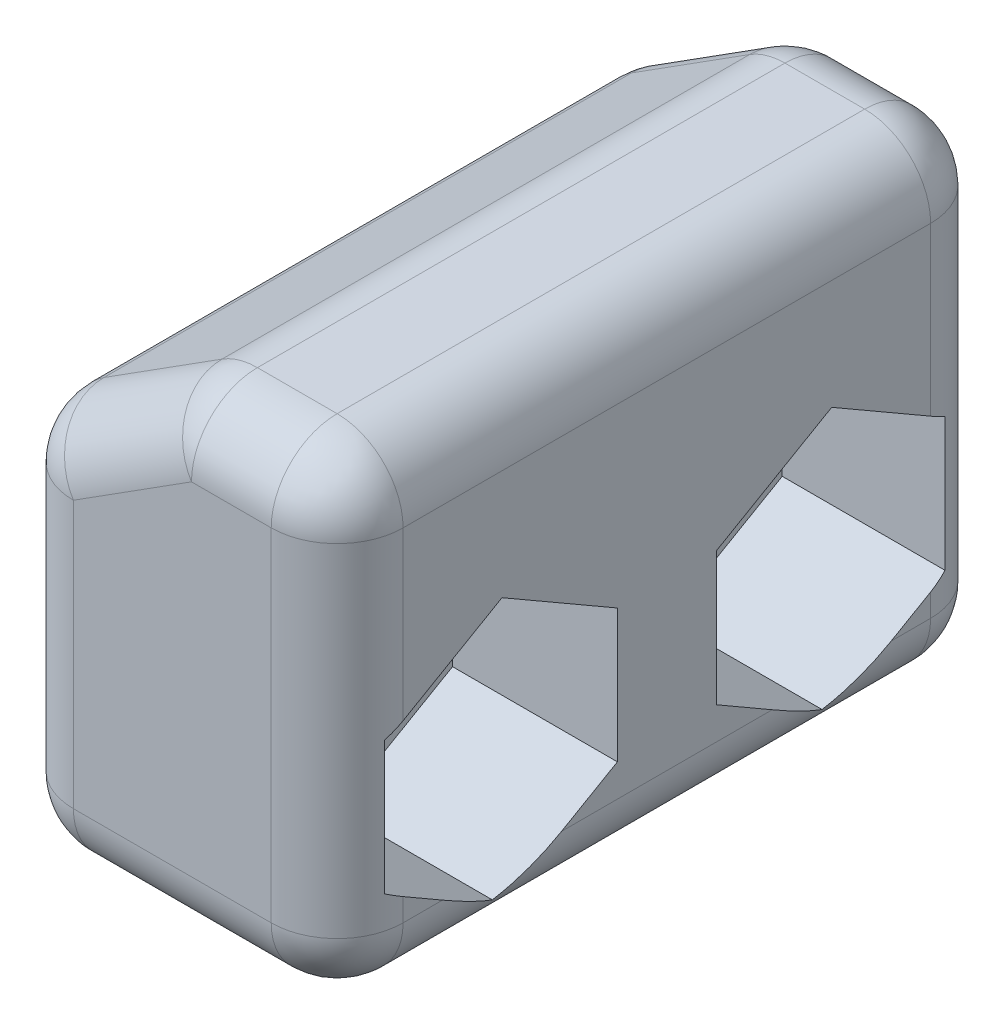
from build123d import *

# Parameters (mm, degrees)
BOSS_EXTRUDE1_DEPTH = 25.4
SKETCH4_R           = 2.159
CUT_EXTRUDE1_DEPTH  = 34.76004538
CUT_EXTRUDE2_DEPTH  = 6.35
FILLET1_R           = 2.54


with BuildPart() as part:
    # Sketch3 → Boss-Extrude1 (new body)
    with BuildSketch(Plane.XY):
        Polygon((0, 14.224), (6.35, 18.25625), (12.7, 18.25625), (12.7, 0), (0, 0), align=None)
    extrude(amount=BOSS_EXTRUDE1_DEPTH)

    # Sketch4 → Cut-Extrude1 (cut, through all)
    with BuildSketch(Plane.ZY):
        with Locations((6.35, 6.35)):
            Circle(SKETCH4_R)
        with Locations((19.05, 6.35)):
            Circle(SKETCH4_R)
    extrude(amount=-CUT_EXTRUDE1_DEPTH, mode=Mode.SUBTRACT)

    # Sketch6 → Cut-Extrude2 (cut)
    with BuildSketch(Plane(origin=(12.7, 0, 0), x_dir=(0, 0, -1), z_dir=(1, 0, 0))):
        Polygon((-14.605, 8.916321947), (-19.05, 11.482643893), (-23.495, 8.916321947), (-23.495, 3.783678053), (-19.05, 1.217356107), (-14.605, 3.783678053), align=None)
        Polygon((-1.905, 3.783678053), (-1.905, 8.916321947), (-6.35, 11.482643893), (-10.795, 8.916321947), (-10.795, 3.783678053), (-6.35, 1.217356107), align=None)
    extrude(amount=-CUT_EXTRUDE2_DEPTH, mode=Mode.SUBTRACT)

    # Fillet1
    # the kernel refuses this fillet: 2.54 mm, written as the material it takes off along each edge
    with BuildSketch(Plane(origin=(2.54, 2.54, 2.54), x_dir=(0, 0, -1), z_dir=(-1, 0, 0))) as fillet1_piece_1_section:
        Polygon((0, 0), (FILLET1_R, 0), (FILLET1_R, FILLET1_R), (0, FILLET1_R), align=None)
    fillet1_piece_1 = extrude(amount=FILLET1_R, mode=Mode.PRIVATE)
    fillet1_piece_1 = fillet1_piece_1 - Plane(origin=(2.54, 2.54, 2.54), x_dir=(0, 0.7071067811865475, 0.7071067811865475), z_dir=(-1, 0, 0)) * Sphere(FILLET1_R, mode=Mode.PRIVATE)
    add(fillet1_piece_1, mode=Mode.SUBTRACT)
    with BuildSketch(Plane(origin=(2.54, 2.54, 22.86), x_dir=(0, 0, 1), z_dir=(-1, 0, 0))) as fillet1_piece_2_section:
        Polygon((0, 0), (FILLET1_R, 0), (FILLET1_R, -FILLET1_R), (0, -FILLET1_R), align=None)
    fillet1_piece_2 = extrude(amount=FILLET1_R, mode=Mode.PRIVATE)
    fillet1_piece_2 = fillet1_piece_2 - Plane(origin=(2.54, 2.54, 22.86), x_dir=(0, 0.7071067811865475, -0.7071067811865475), z_dir=(-1, 0, 0)) * Sphere(FILLET1_R, mode=Mode.PRIVATE)
    add(fillet1_piece_2, mode=Mode.SUBTRACT)
    with BuildSketch(Plane(origin=(10.16, 2.54, 2.54), x_dir=(0, 0, -1), z_dir=(1, 0, 0))) as fillet1_piece_3_section:
        Polygon((0, 0), (FILLET1_R, 0), (FILLET1_R, -FILLET1_R), (0, -FILLET1_R), align=None)
    fillet1_piece_3 = extrude(amount=FILLET1_R, mode=Mode.PRIVATE)
    fillet1_piece_3 = fillet1_piece_3 - Plane(origin=(10.16, 2.54, 2.54), x_dir=(0, 0.7071067811865475, 0.7071067811865475), z_dir=(1, 0, 0)) * Sphere(FILLET1_R, mode=Mode.PRIVATE)
    add(fillet1_piece_3, mode=Mode.SUBTRACT)
    with BuildSketch(Plane(origin=(10.16, 2.54, 22.86), x_dir=(0, 0, 1), z_dir=(1, 0, 0))) as fillet1_piece_4_section:
        Polygon((0, 0), (FILLET1_R, 0), (FILLET1_R, FILLET1_R), (0, FILLET1_R), align=None)
    fillet1_piece_4 = extrude(amount=FILLET1_R, mode=Mode.PRIVATE)
    fillet1_piece_4 = fillet1_piece_4 - Plane(origin=(10.16, 2.54, 22.86), x_dir=(0, 0.7071067811865475, -0.7071067811865475), z_dir=(1, 0, 0)) * Sphere(FILLET1_R, mode=Mode.PRIVATE)
    add(fillet1_piece_4, mode=Mode.SUBTRACT)
    with BuildSketch(Plane(origin=(10.16, 15.71625, 2.54), x_dir=(0, 1, 0), z_dir=(1, 0, 0))) as fillet1_piece_5_section:
        Polygon((0, 0), (FILLET1_R, 0), (FILLET1_R, -FILLET1_R), (0, -FILLET1_R), align=None)
    fillet1_piece_5 = extrude(amount=FILLET1_R, mode=Mode.PRIVATE)
    fillet1_piece_5 = fillet1_piece_5 - Plane(origin=(10.16, 15.71625, 2.54), x_dir=(0, -0.7071067811865475, 0.7071067811865475), z_dir=(1, 0, 0)) * Sphere(FILLET1_R, mode=Mode.PRIVATE)
    add(fillet1_piece_5, mode=Mode.SUBTRACT)
    with BuildSketch(Plane(origin=(10.16, 15.71625, 22.86), x_dir=(0, 1, 0), z_dir=(1, 0, 0))) as fillet1_piece_6_section:
        Polygon((0, 0), (FILLET1_R, 0), (FILLET1_R, FILLET1_R), (0, FILLET1_R), align=None)
    fillet1_piece_6 = extrude(amount=FILLET1_R, mode=Mode.PRIVATE)
    fillet1_piece_6 = fillet1_piece_6 - Plane(origin=(10.16, 15.71625, 22.86), x_dir=(0, -0.7071067811865475, -0.7071067811865475), z_dir=(1, 0, 0)) * Sphere(FILLET1_R, mode=Mode.PRIVATE)
    add(fillet1_piece_6, mode=Mode.SUBTRACT)
    with BuildSketch(Plane(origin=(7.088311936, 15.71625, 2.54), x_dir=(-0.5360558854014316, 0.8441824966951682, 0), z_dir=(0, 0, -1))) as fillet1_piece_7_section:
        Polygon((0, 0), (FILLET1_R, 0), (FILLET1_R, FILLET1_R * 0.290673990433), (FILLET1_R * 0.844182496695, FILLET1_R * 0.536055885401), align=None)
    fillet1_piece_7 = extrude(amount=FILLET1_R, mode=Mode.PRIVATE)
    fillet1_piece_7 = fillet1_piece_7 - Plane(origin=(7.088311936, 15.71625, 2.54), x_dir=(0.2791213923231542, -0.9602558244278364, 0), z_dir=(0, 0, -1)) * Sphere(FILLET1_R, mode=Mode.PRIVATE)
    add(fillet1_piece_7, mode=Mode.SUBTRACT)
    with BuildSketch(Plane(origin=(7.088311936, 15.71625, 22.86), x_dir=(-0.5360558854014316, 0.8441824966951682, 0), z_dir=(0, 0, 1))) as fillet1_piece_8_section:
        Polygon((0, 0), (FILLET1_R, 0), (FILLET1_R, -FILLET1_R * 0.290673990433), (FILLET1_R * 0.844182496695, -FILLET1_R * 0.536055885401), align=None)
    fillet1_piece_8 = extrude(amount=FILLET1_R, mode=Mode.PRIVATE)
    fillet1_piece_8 = fillet1_piece_8 - Plane(origin=(7.088311936, 15.71625, 22.86), x_dir=(0.2791213923231542, -0.9602558244278364, 0), z_dir=(0, 0, 1)) * Sphere(FILLET1_R, mode=Mode.PRIVATE)
    add(fillet1_piece_8, mode=Mode.SUBTRACT)
    with BuildSketch(Plane(origin=(2.54, 12.828071921, 22.86), x_dir=(-0.5360558854014316, 0.8441824966951682, 0), z_dir=(0, 0, 1))) as fillet1_piece_9_section:
        Polygon((0, 0), (FILLET1_R, 0), (FILLET1_R, FILLET1_R * 0.549577983925), (FILLET1_R * 0.536055885401, FILLET1_R * 0.844182496695), align=None)
    fillet1_piece_9 = extrude(amount=FILLET1_R, mode=Mode.PRIVATE)
    fillet1_piece_9 = fillet1_piece_9 - Plane(origin=(2.54, 12.828071921, 22.86), x_dir=(0.8763720344127349, -0.4816347758408693, 0), z_dir=(0, 0, 1)) * Sphere(FILLET1_R, mode=Mode.PRIVATE)
    add(fillet1_piece_9, mode=Mode.SUBTRACT)
    with BuildSketch(Plane(origin=(2.54, 12.828071921, 2.54), x_dir=(-0.5360558854014316, 0.8441824966951682, 0), z_dir=(0, 0, -1))) as fillet1_piece_10_section:
        Polygon((0, 0), (FILLET1_R, 0), (FILLET1_R, -FILLET1_R * 0.549577983925), (FILLET1_R * 0.536055885401, -FILLET1_R * 0.844182496695), align=None)
    fillet1_piece_10 = extrude(amount=FILLET1_R, mode=Mode.PRIVATE)
    fillet1_piece_10 = fillet1_piece_10 - Plane(origin=(2.54, 12.828071921, 2.54), x_dir=(0.8763720344127349, -0.4816347758408693, 0), z_dir=(0, 0, -1)) * Sphere(FILLET1_R, mode=Mode.PRIVATE)
    add(fillet1_piece_10, mode=Mode.SUBTRACT)
    with BuildSketch(Plane(origin=(0, 0, 2.54), x_dir=(0, 1, 0), z_dir=(0, 0, 1)), Plane(origin=(12.7, 0, 2.54), x_dir=(-1, 0, 0), z_dir=(0, 0, 1))) as fillet1_piece_11:
        with BuildLine():
            CenterArc((FILLET1_R, -FILLET1_R), FILLET1_R, 90, 90)
            Line((0, -FILLET1_R), (0, 0))
            Line((0, 0), (FILLET1_R, 0))
        make_face()
    extrude(amount=20.32, mode=Mode.SUBTRACT)
    with BuildSketch(Plane(origin=(12.7, 18.25625, 2.54), x_dir=(-1, 0, 0), z_dir=(0, 0, 1))) as fillet1_piece_12:
        with BuildLine():
            CenterArc((FILLET1_R, FILLET1_R), FILLET1_R, 180, 90)
            Line((0, FILLET1_R), (0, 0))
            Line((0, 0), (FILLET1_R, 0))
        make_face()
    extrude(amount=20.32, mode=Mode.SUBTRACT)
    with BuildSketch(Plane(origin=(6.35, 18.25625, 2.54), x_dir=(-0.8441824966951671, -0.536055885401433, 0), z_dir=(0, 0, 1))) as fillet1_piece_13:
        with BuildLine():
            CenterArc((FILLET1_R * 0.290673990433, FILLET1_R), FILLET1_R, 237.58445267, 32.41554733)
            Line((-FILLET1_R * 0.245381894968, FILLET1_R * 0.155817503305), (0, 0))
            Line((0, 0), (FILLET1_R * 0.290673990433, 0))
        make_face()
    extrude(amount=20.32, mode=Mode.SUBTRACT)
    with BuildSketch(Plane(origin=(1.178418051, 14.972295462, 25.4), x_dir=(0, 0, -1), z_dir=(0.844182496695168, 0.5360558854014315, 0))) as fillet1_piece_14:
        with BuildLine():
            CenterArc((FILLET1_R, -FILLET1_R), FILLET1_R, 90, 90)
            Line((0, -FILLET1_R), (0, 0))
            Line((0, 0), (FILLET1_R, 0))
        make_face()
    extrude(amount=5.387830183, mode=Mode.SUBTRACT)
    with BuildSketch(Plane(origin=(7.088311936, 18.25625, 25.4), x_dir=(0, 0, -1), z_dir=(1, 0, 0))) as fillet1_piece_15:
        with BuildLine():
            CenterArc((FILLET1_R, -FILLET1_R), FILLET1_R, 90, 90)
            Line((0, -FILLET1_R), (0, 0))
            Line((0, 0), (FILLET1_R, 0))
        make_face()
    extrude(amount=3.071688064, mode=Mode.SUBTRACT)
    with BuildSketch(Plane(origin=(12.7, 15.71625, 25.4), x_dir=(-1, 0, 0), z_dir=(0, -1, 0))) as fillet1_piece_16:
        with BuildLine():
            CenterArc((FILLET1_R, FILLET1_R), FILLET1_R, 180, 90)
            Line((0, FILLET1_R), (0, 0))
            Line((0, 0), (FILLET1_R, 0))
        make_face()
    extrude(amount=13.17625, mode=Mode.SUBTRACT)
    with BuildSketch(Plane(origin=(10.16, 0, 25.4), x_dir=(0, 1, 0), z_dir=(-1, 0, 0))) as fillet1_piece_17:
        with BuildLine():
            CenterArc((FILLET1_R, FILLET1_R), FILLET1_R, 180, 90)
            Line((0, FILLET1_R), (0, 0))
            Line((0, 0), (FILLET1_R, 0))
        make_face()
    extrude(amount=7.62, mode=Mode.SUBTRACT)
    with BuildSketch(Plane(origin=(0, 2.54, 25.4), x_dir=(0, 0, -1), z_dir=(0, 1, 0))) as fillet1_piece_18:
        with BuildLine():
            CenterArc((FILLET1_R, -FILLET1_R), FILLET1_R, 90, 90)
            Line((0, -FILLET1_R), (0, 0))
            Line((0, 0), (FILLET1_R, 0))
        make_face()
    extrude(amount=10.288071921, mode=Mode.SUBTRACT)
    with BuildSketch(Plane(origin=(10.16, 0, 0), x_dir=(0, 1, 0), z_dir=(-1, 0, 0))) as fillet1_piece_19:
        with BuildLine():
            CenterArc((FILLET1_R, -FILLET1_R), FILLET1_R, 90, 90)
            Line((0, -FILLET1_R), (0, 0))
            Line((0, 0), (FILLET1_R, 0))
        make_face()
    extrude(amount=7.62, mode=Mode.SUBTRACT)
    with BuildSketch(Plane(origin=(12.7, 15.71625, 0), x_dir=(-1, 0, 0), z_dir=(0, -1, 0))) as fillet1_piece_20:
        with BuildLine():
            CenterArc((FILLET1_R, -FILLET1_R), FILLET1_R, 90, 90)
            Line((0, -FILLET1_R), (0, 0))
            Line((0, 0), (FILLET1_R, 0))
        make_face()
    extrude(amount=13.17625, mode=Mode.SUBTRACT)
    with BuildSketch(Plane(origin=(7.088311936, 18.25625, 0), x_dir=(0, 0, 1), z_dir=(1, 0, 0))) as fillet1_piece_21:
        with BuildLine():
            CenterArc((FILLET1_R, FILLET1_R), FILLET1_R, 180, 90)
            Line((0, FILLET1_R), (0, 0))
            Line((0, 0), (FILLET1_R, 0))
        make_face()
    extrude(amount=3.071688064, mode=Mode.SUBTRACT)
    with BuildSketch(Plane(origin=(1.178418051, 14.972295462, 0), x_dir=(0, 0, 1), z_dir=(0.844182496695168, 0.5360558854014315, 0))) as fillet1_piece_22:
        with BuildLine():
            CenterArc((FILLET1_R, FILLET1_R), FILLET1_R, 180, 90)
            Line((0, FILLET1_R), (0, 0))
            Line((0, 0), (FILLET1_R, 0))
        make_face()
    extrude(amount=5.387830183, mode=Mode.SUBTRACT)
    with BuildSketch(Plane(origin=(0, 2.54, 0), x_dir=(0, 0, 1), z_dir=(0, 1, 0))) as fillet1_piece_23:
        with BuildLine():
            CenterArc((FILLET1_R, FILLET1_R), FILLET1_R, 180, 90)
            Line((0, FILLET1_R), (0, 0))
            Line((0, 0), (FILLET1_R, 0))
        make_face()
    extrude(amount=10.288071921, mode=Mode.SUBTRACT)
    with BuildSketch(Plane(origin=(0, 14.224, 2.54), x_dir=(0.844182496695168, 0.5360558854014316, 0), z_dir=(0, 0, 1))) as fillet1_piece_24:
        with BuildLine():
            CenterArc((FILLET1_R * 0.549577983925, -FILLET1_R), FILLET1_R, 90, 57.58445267)
            Line((-FILLET1_R * 0.29460451277, -FILLET1_R * 0.463944114599), (0, 0))
            Line((0, 0), (FILLET1_R * 0.549577983925, 0))
        make_face()
    extrude(amount=20.32, mode=Mode.SUBTRACT)


solid = part.part
